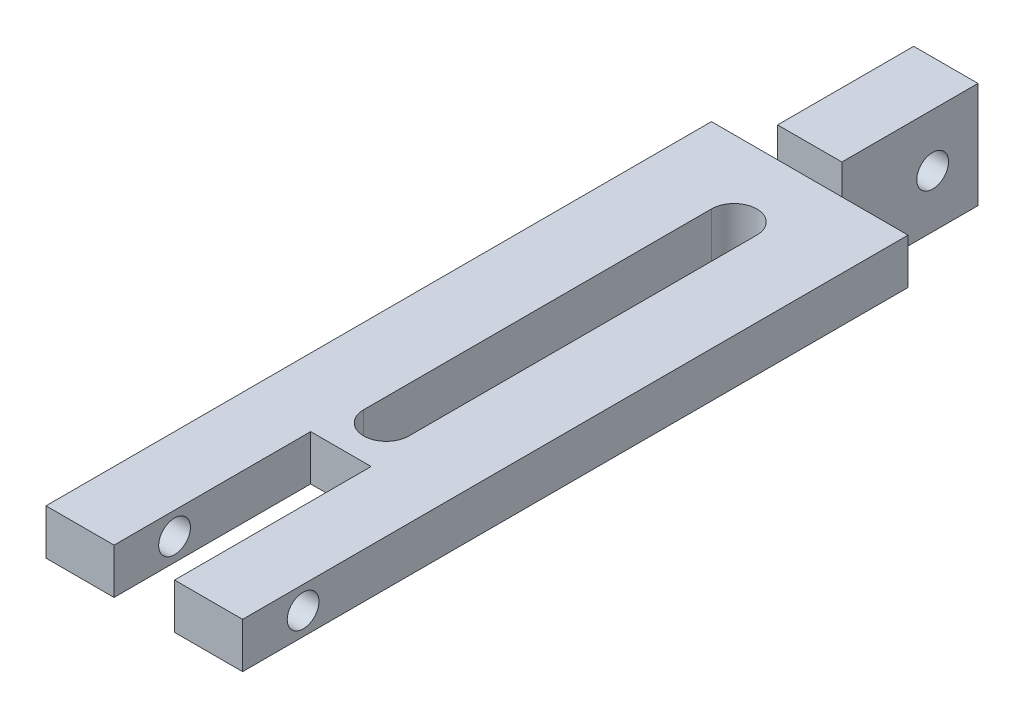
from build123d import *

# Parameters (mm, degrees)
F_01_ARM_BODY_DEPTH      = 3
SKETCH_2_W               = 8.5
SKETCH_2_H               = 18
F_02_NECK_BLOCK_DEPTH    = 7
F_03_SLOT_F_DEPTH        = 102.084123382
F_03_SLOT_B_DEPTH        = 102.084123382
SKETCH_5_R               = 2.1
F_04_PINHOLE_BOT_R_DEPTH = 102.084123382
SKETCH_6_R               = 2.1
F_04_PINHOLE_BOT_L_DEPTH = 102.084123382
SKETCH_7_R               = 2.1
F_04_PINHOLE_TOP_R_DEPTH = 102.084123382
SKETCH_8_R               = 2.1
F_04_PINHOLE_TOP_L_DEPTH = 102.084123382


with BuildPart() as part:
    # 草图1 → 01_ARM_BODY (new, symmetric)
    with BuildSketch(Plane(origin=(0, 0, 0), x_dir=(1, 0, 0), z_dir=(0, 1, 0))):
        Polygon((-4.25, 6), (4.25, 6), (4.25, -12), (13, -12), (13, -74), (13, -100), (4, -100), (4, -74), (-4, -74), (-4, -100), (-13, -100), (-13, -74), (-13, -12), (-4.25, -12), align=None)
    extrude(amount=F_01_ARM_BODY_DEPTH, both=True)

    # 草图2 → 02_NECK_BLOCK (add, symmetric)
    with BuildSketch(Plane(origin=(0, 0, 0), x_dir=(1, 0, 0), z_dir=(0, 1, 0))):
        with Locations((0, -3)):
            Rectangle(SKETCH_2_W, SKETCH_2_H)
    extrude(amount=F_02_NECK_BLOCK_DEPTH, both=True)

    # 草图3 → 03_SLOT_F (cut, through all)
    with BuildSketch(Plane(origin=(0, 0, 0), x_dir=(1, 0, 0), z_dir=(0, 1, 0))):
        with BuildLine():
            Line((3, -22), (3, -68))
            ThreePointArc((3, -68), (0, -71), (-3, -68))
            Line((-3, -68), (-3, -22))
            ThreePointArc((-3, -22), (0, -19), (3, -22))
        make_face()
    extrude(amount=F_03_SLOT_F_DEPTH, mode=Mode.SUBTRACT)

    # 草图4 → 03_SLOT_B (cut, through all)
    with BuildSketch(Plane(origin=(0, 0, 0), x_dir=(1, 0, 0), z_dir=(0, 1, 0))):
        with BuildLine():
            Line((3, -22), (3, -68))
            ThreePointArc((3, -68), (0, -71), (-3, -68))
            Line((-3, -68), (-3, -22))
            ThreePointArc((-3, -22), (0, -19), (3, -22))
        make_face()
    extrude(amount=-F_03_SLOT_B_DEPTH, mode=Mode.SUBTRACT)

    # 草图5 → 04_PINHOLE_BOT_R (cut, through all)
    with BuildSketch(Plane(origin=(0, 0, 0), x_dir=(0, 0, -1), z_dir=(1, 0, 0))):
        Circle(SKETCH_5_R)
    extrude(amount=F_04_PINHOLE_BOT_R_DEPTH, mode=Mode.SUBTRACT)

    # 草图6 → 04_PINHOLE_BOT_L (cut, through all)
    with BuildSketch(Plane(origin=(0, 0, 0), x_dir=(0, 0, -1), z_dir=(1, 0, 0))):
        Circle(SKETCH_6_R)
    extrude(amount=-F_04_PINHOLE_BOT_L_DEPTH, mode=Mode.SUBTRACT)

    # 草图7 → 04_PINHOLE_TOP_R (cut, through all)
    with BuildSketch(Plane(origin=(0, 0, 0), x_dir=(0, 0, -1), z_dir=(1, 0, 0))):
        with Locations((-92, 0)):
            Circle(SKETCH_7_R)
    extrude(amount=F_04_PINHOLE_TOP_R_DEPTH, mode=Mode.SUBTRACT)

    # 草图8 → 04_PINHOLE_TOP_L (cut, through all)
    with BuildSketch(Plane(origin=(0, 0, 0), x_dir=(0, 0, -1), z_dir=(1, 0, 0))):
        with Locations((-92, 0)):
            Circle(SKETCH_8_R)
    extrude(amount=-F_04_PINHOLE_TOP_L_DEPTH, mode=Mode.SUBTRACT)


solid = part.part
